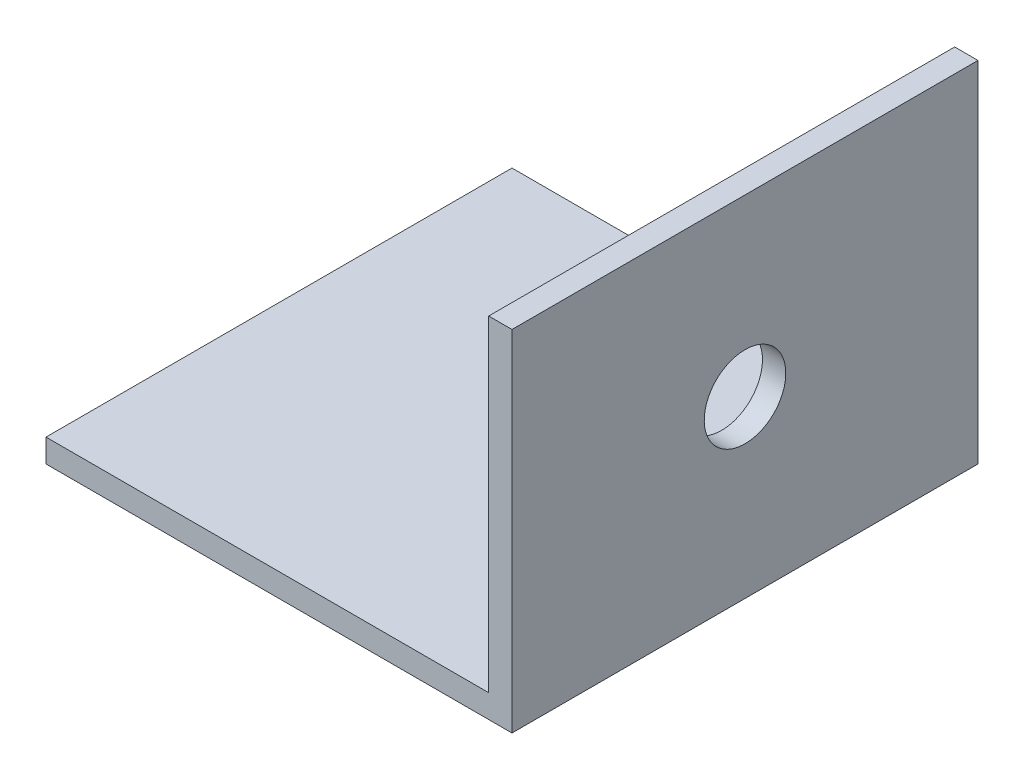
from build123d import *

# Parameters (mm, degrees)
SALIENTE_EXTRUIR1_DEPTH = 40
CROQUIS2_R              = 3.5
CORTAR_EXTRUIR1_DEPTH   = 64.2003722


with BuildPart() as part:
    # Croquis1 → Saliente-Extruir1 (new body)
    with BuildSketch(Plane.XY):
        Polygon((0.551367026, 28.183098592), (0.551367026, -1.816901408), (-39.448632974, -1.816901408), (-39.448632974, 0.183098592), (-1.448632974, 0.183098592), (-1.448632974, 28.183098592), align=None)
    extrude(amount=SALIENTE_EXTRUIR1_DEPTH)

    # Croquis2 → Cortar-Extruir1 (cut, through all)
    with BuildSketch(Plane(origin=(0.551367026, 0, 0), x_dir=(0, 0, -1), z_dir=(1, 0, 0))):
        with Locations((-20, 13.183098592)):
            Circle(CROQUIS2_R)
    extrude(amount=-CORTAR_EXTRUIR1_DEPTH, mode=Mode.SUBTRACT)


solid = part.part
